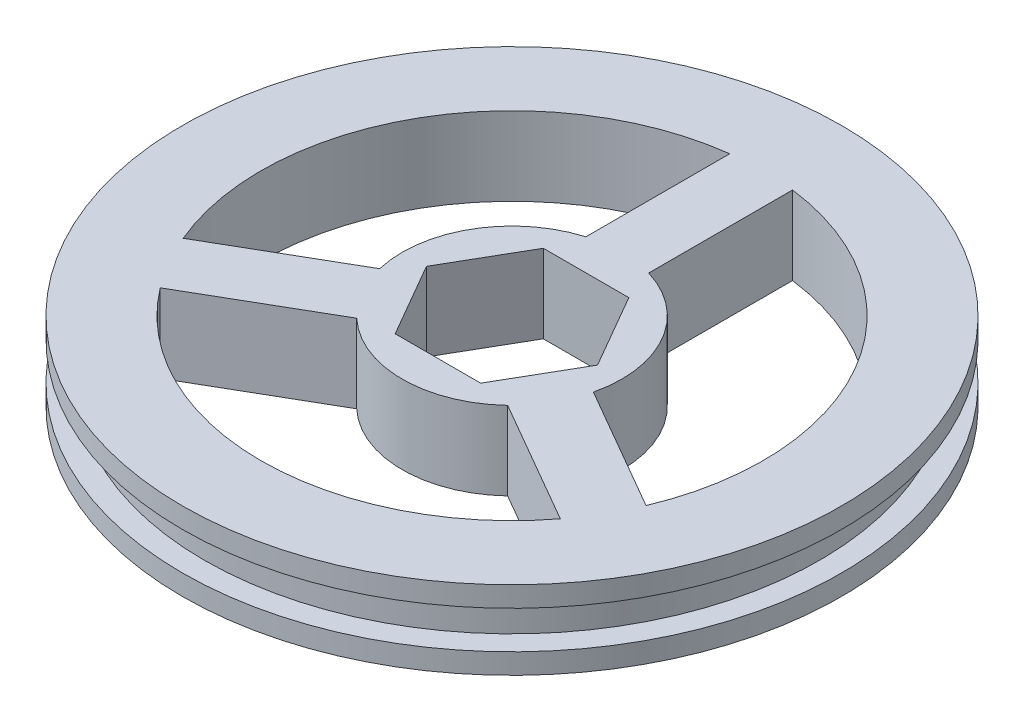
from build123d import *

# Parameters (mm, degrees)
SKETCH1_R           = 26.67
BOSS_EXTRUDE1_DEPTH = 6.35
SHELL3_START        = 1.651
SHELL3_OUTLINE_R    = 26.67
SHELL3_DEPTH        = 3.048
BOSS_EXTRUDE3_START = -6.35
SKETCH7_R           = 24.892
SKETCH7_R_2         = 20.32
BOSS_EXTRUDE3_DEPTH = 6.35


# Read off the part's stored shape, not the designer's step: Shell3
with BuildPart() as part:
    # Sketch1 → Boss-Extrude1 (new body)
    with BuildSketch(Plane(origin=(0, 0, 0), x_dir=(1, 0, 0), z_dir=(0, 1, 0))):
        with Locations(Location((0, 0, 0), (0, 0, 270))):
            Circle(SKETCH1_R)
        Polygon((-5.19130268, 2.9972), (-6.921736907, 0), (-5.19130268, -2.9972), (-3.460868454, -5.9944), (3.460868454, -5.9944), (5.19130268, -2.9972), (6.921736907, 0), (5.19130268, 2.9972), (3.460868454, 5.9944), (-3.460868454, 5.9944), align=None, mode=Mode.SUBTRACT)
        with BuildLine():
            Line((-6.108033275, -6.459414023), (-16.189613398, -12.280017021))
            ThreePointArc((-16.189613398, -12.280017021), (0, -20.32), (16.189613398, -12.280017021))
            Line((16.189613398, -12.280017021), (6.108033275, -6.459414023))
            ThreePointArc((6.108033275, -6.459414023), (0, -8.89), (-6.108033275, -6.459414023))
        make_face(mode=Mode.SUBTRACT)
        with BuildLine():
            Line((-2.54, 8.519418994), (-2.54, 20.16062499))
            ThreePointArc((-2.54, 20.16062499), (-17.597636205, 10.16), (-18.729613398, -7.88060797))
            Line((-18.729613398, -7.88060797), (-8.648033275, -2.060004972))
            ThreePointArc((-8.648033275, -2.060004972), (-7.69896584, 4.445), (-2.54, 8.519418994))
        make_face(mode=Mode.SUBTRACT)
        with BuildLine():
            Line((8.648033275, -2.060004972), (18.729613398, -7.88060797))
            ThreePointArc((18.729613398, -7.88060797), (17.597636205, 10.16), (2.54, 20.16062499))
            Line((2.54, 20.16062499), (2.54, 8.519418994))
            ThreePointArc((2.54, 8.519418994), (7.69896584, 4.445), (8.648033275, -2.060004972))
        make_face(mode=Mode.SUBTRACT)
    extrude(amount=BOSS_EXTRUDE1_DEPTH)

    # Shell3 outline → Shell3 (cut)
    with BuildSketch(Plane(origin=(0, 0, 0), x_dir=(1, 0, 0), z_dir=(0, 1, 0)).offset(SHELL3_START)):
        Circle(SHELL3_OUTLINE_R)
        with BuildLine():
            ThreePointArc((0.889, 21.953007083), (19.027444147, 10.9855), (19.456361824, -10.206606958))
            Line((19.456361824, -10.206606958), (7.065610622, -3.052803416))
            Line((7.065610622, -3.052803416), (6.176610622, -4.592596584))
            Line((6.176610622, -4.592596584), (18.567361824, -11.746400126))
            ThreePointArc((18.567361824, -11.746400126), (0, -21.971), (-18.567361824, -11.746400126))
            Line((-18.567361824, -11.746400126), (-6.176610622, -4.592596584))
            Line((-6.176610622, -4.592596584), (-7.065610622, -3.052803416))
            Line((-7.065610622, -3.052803416), (-19.456361824, -10.206606958))
            ThreePointArc((-19.456361824, -10.206606958), (-19.027444147, 10.9855), (-0.889, 21.953007083))
            Line((-0.889, 21.953007083), (-0.889, 7.6454))
            Line((-0.889, 7.6454), (0.889, 7.6454))
            Line((0.889, 7.6454), (0.889, 21.953007083))
        make_face(mode=Mode.SUBTRACT)
    extrude(amount=SHELL3_DEPTH, mode=Mode.SUBTRACT)

    # Sketch7 → Boss-Extrude3 (add)
    with BuildSketch(Plane(origin=(0, 6.35, 0), x_dir=(1, 0, 0), z_dir=(0, 1, 0)).offset(BOSS_EXTRUDE3_START)):
        with Locations(Location((0, 0, 0), (0, 0, 270))):
            Circle(SKETCH7_R)
        Circle(SKETCH7_R_2, mode=Mode.SUBTRACT)
    extrude(amount=BOSS_EXTRUDE3_DEPTH)


solid = part.part
